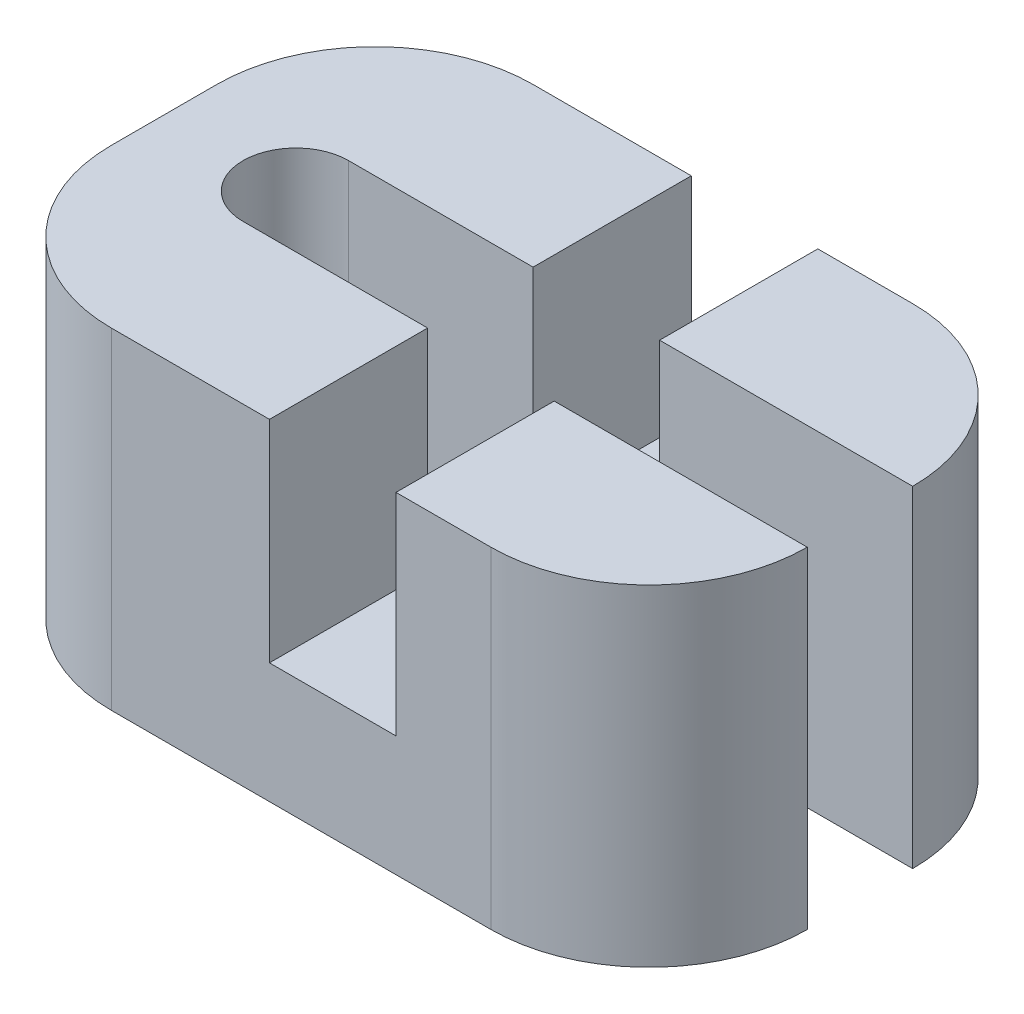
from build123d import *

# Parameters (mm, degrees)
CROQUIS1_W              = 33
CROQUIS1_H              = 20
SALIENTE_EXTRUIR1_DEPTH = 15.7
CORTAR_EXTRUIR1_REACH   = 27.894
CROQUIS2_R              = 2.5
CROQUIS6_W              = 6
CROQUIS6_H              = 20
CORTAR_EXTRUIR2_DEPTH   = 10
CORTAR_EXTRUIR3_START   = -15.7
CROQUIS7_W              = 26.75
CROQUIS7_H              = 5
CORTAR_EXTRUIR3_DEPTH   = 15.7
REDONDEO1_R             = 7.5


with BuildPart() as part:
    # Croquis1 → Saliente-Extruir1 (new body)
    with BuildSketch(Plane(origin=(0, 0, 0), x_dir=(1, 0, 0), z_dir=(0, 1, 0))):
        with Locations((-1.5, 0)):
            Rectangle(CROQUIS1_W, CROQUIS1_H)
    extrude(amount=SALIENTE_EXTRUIR1_DEPTH)

    # Croquis2 → Cortar-Extruir1 (cut, up to next)
    with BuildSketch(Plane(origin=(0, 15.7, 0), x_dir=(1, 0, 0), z_dir=(0, 1, 0)), mode=Mode.PRIVATE) as cortar_extruir1_sk1:
        with Locations(Location((11.75, 0, 0), (0, 0, 270))):
            Circle(CROQUIS2_R)
    cortar_extruir1_tool1 = extrude(cortar_extruir1_sk1.sketch, amount=-CORTAR_EXTRUIR1_REACH, mode=Mode.PRIVATE) & part.part
    # Croquis2 → Cortar-Extruir1 (cut, up to next)
    with BuildSketch(Plane(origin=(0, 15.7, 0), x_dir=(1, 0, 0), z_dir=(0, 1, 0)), mode=Mode.PRIVATE) as cortar_extruir1_sk2:
        with Locations(Location((-11.75, 0, 0), (0, 0, 270))):
            Circle(CROQUIS2_R)
    cortar_extruir1_tool2 = extrude(cortar_extruir1_sk2.sketch, amount=-CORTAR_EXTRUIR1_REACH, mode=Mode.PRIVATE) & part.part
    add(cortar_extruir1_tool1.solids().sort_by_distance((11.75, 15.7, 0))[0], mode=Mode.SUBTRACT)
    add(cortar_extruir1_tool2.solids().sort_by_distance((-11.75, 15.7, 0))[0], mode=Mode.SUBTRACT)

    # Croquis6 → Cortar-Extruir2 (cut)
    with BuildSketch(Plane(origin=(0, 15.7, 0), x_dir=(1, 0, 0), z_dir=(0, 1, 0))):
        Rectangle(CROQUIS6_W, CROQUIS6_H)
    extrude(amount=-CORTAR_EXTRUIR2_DEPTH, mode=Mode.SUBTRACT)

    # Croquis7 → Cortar-Extruir3 (cut)
    with BuildSketch(Plane(origin=(0, 15.7, 0), x_dir=(1, 0, 0), z_dir=(0, 1, 0)).offset(CORTAR_EXTRUIR3_START)):
        with Locations((1.625, 0)):
            Rectangle(CROQUIS7_W, CROQUIS7_H)
    extrude(amount=CORTAR_EXTRUIR3_DEPTH, mode=Mode.SUBTRACT)

    # Redondeo1
    redondeo1_edges = [part.edges().sort_by_distance(p)[0] for p in [
        (-18, 7.85, -10),
        (-18, 7.85, 10),
        (15, 7.85, -10),
        (15, 7.85, 10),
    ]]
    fillet(redondeo1_edges, radius=REDONDEO1_R - 0.0001)  # a hair under: the kernel refuses the full size


solid = part.part
